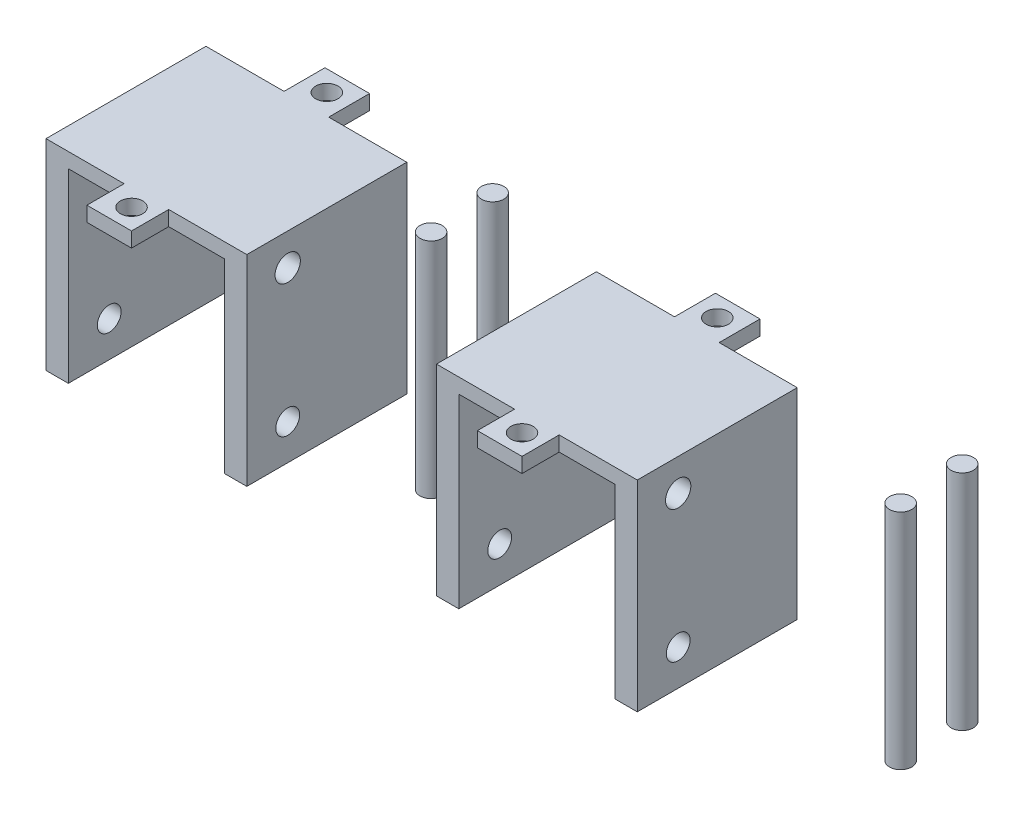
from build123d import *

# Parameters (mm, degrees)
SKETCH1_W                 = 27
SKETCH1_H                 = 27
BOSS_EXTRUDE1_DEPTH       = 36.7
SKETCH2_W                 = 21
SKETCH2_H                 = 25
CUT_EXTRUDE1_DEPTH        = 36.7
SKETCH3_R                 = 1.7
SKETCH3_R_2               = 1.6
CUT_EXTRUDE2_DEPTH        = 36.7
SKETCH4_R                 = 3
CUT_EXTRUDE3_DEPTH        = 36.7
SKETCH8_R                 = 1.5
BOSS_EXTRUDE3_DEPTH       = 30
BOSS_EXTRUDE3_2_DEPTH     = 30
SKETCH9_W                 = 5.918746276
SKETCH9_H                 = 6
SKETCH9_W_2               = 6.707912446
CUT_EXTRUDE4_DEPTH        = 12
SKETCH11_W                = 15.191448775
SKETCH11_H                = 37.067540439
CUT_EXTRUDE6_DEPTH        = 32
SKETCH15_W                = 6
SKETCH15_H                = 12.008551225
SKETCH15_R                = 1.5
BOSS_EXTRUDE5_DEPTH       = 2.5
SKETCH17_W                = 99.088440485
SKETCH17_H                = 65.829588933
CUT_EXTRUDE9_DEPTH        = 50
SKETCH18_W                = 6
SKETCH18_H                = 2
BOSS_EXTRUDE6_DEPTH       = 5
SKETCH19_R                = 1.5
CUT_EXTRUDE10_DEPTH       = 5
SKETCH20_W                = 6
SKETCH20_H                = 5.5
SKETCH20_R                = 1.5
BOSS_EXTRUDE7_DEPTH       = 2
BODY_MOVE_COPY8_START     = -37.96401366
BODY_MOVE_COPY8_OUTLINE_R = 1.5
BODY_MOVE_COPY8_DEPTH     = 30


# Read off the part's stored shape, not the designer's step: Body-Move/Copy8
with BuildPart() as part:
    # Sketch1 → Boss-Extrude1 (new body)
    with BuildSketch(Plane.XY):
        with Locations((-15.677732696, -21.46401366)):
            Rectangle(SKETCH1_W, SKETCH1_H)
    extrude(amount=BOSS_EXTRUDE1_DEPTH)

    # Sketch2 → Cut-Extrude1 (cut)
    with BuildSketch(Plane(origin=(0, 0, 0), x_dir=(-1, 0, 0), z_dir=(0, 0, -1))):
        with Locations((15.677732696, -22.46401366)):
            Rectangle(SKETCH2_W, SKETCH2_H)
    extrude(amount=-CUT_EXTRUDE1_DEPTH, mode=Mode.SUBTRACT)

    # Sketch3 → Cut-Extrude2 (cut)
    with BuildSketch(Plane(origin=(-2.177732696, 0, 0), x_dir=(0, 0, -1), z_dir=(1, 0, 0))):
        with Locations((-31.2, -12.26401366)):
            Circle(SKETCH3_R)
        with Locations((-31.2, -30.16401366)):
            Circle(SKETCH3_R_2)
    extrude(amount=-CUT_EXTRUDE2_DEPTH, mode=Mode.SUBTRACT)

    # Sketch4 → Cut-Extrude3 (cut)
    with BuildSketch(Plane(origin=(-2.177732696, 0, 0), x_dir=(0, 0, -1), z_dir=(1, 0, 0))):
        with Locations((-12.025092395, -21.16401366)):
            Circle(SKETCH4_R)
    extrude(amount=-CUT_EXTRUDE3_DEPTH, mode=Mode.SUBTRACT)

    # Sketch9 → Cut-Extrude4 (cut)
    with BuildSketch(Plane(origin=(0, 0, 0), x_dir=(-1, 0, 0), z_dir=(0, 0, -1))):
        with Locations((3.689038825, -21.16401366)):
            Rectangle(SKETCH9_W, SKETCH9_H)
        with Locations((28.103867214, -21.16401366)):
            Rectangle(SKETCH9_W_2, SKETCH9_H)
    extrude(amount=-CUT_EXTRUDE4_DEPTH, mode=Mode.SUBTRACT)

    # Sketch11 → Cut-Extrude6 (cut)
    with BuildSketch(Plane.ZY.offset(29.177732696)):
        with Locations((7.595724388, -16.43024344)):
            Rectangle(SKETCH11_W, SKETCH11_H)
    extrude(amount=-CUT_EXTRUDE6_DEPTH, mode=Mode.SUBTRACT)


with BuildPart() as body_2:
    # Sketch8 → Boss-Extrude3 (new body)
    with BuildSketch(Plane(origin=(0, -7.96401366, 0), x_dir=(1, 0, 0), z_dir=(0, 1, 0))):
        with Locations(Location((7.15742756, -12.973989901, 0), (0, 0, 180))):
            Circle(SKETCH8_R)
    extrude(amount=-BOSS_EXTRUDE3_DEPTH)


with BuildPart() as body_3:
    # Sketch8 → Boss-Extrude3 2 (new body)
    with BuildSketch(Plane(origin=(0, -7.96401366, 0), x_dir=(1, 0, 0), z_dir=(0, 1, 0))):
        with Locations(Location((7.574350551, -21.669812293, 0), (0, 0, 180))):
            Circle(SKETCH8_R)
    extrude(amount=-BOSS_EXTRUDE3_2_DEPTH)


with BuildPart() as body_4:
    # Body-Move/Copy4: copy of part
    add(part.part.moved(Location((-70.821628829, 0, 0))))

    # Sketch15 → Boss-Extrude5 (add)
    with BuildSketch(Plane(origin=(0, -7.96401366, 0), x_dir=(1, 0, 0), z_dir=(0, 1, 0))):
        with Locations((-69.999361524, -25.945724388)):
            Rectangle(SKETCH15_W, SKETCH15_H)
        with Locations(Location((-69.999361524, -22.941448775, 0), (0, 0, 180))):
            Circle(SKETCH15_R, mode=Mode.SUBTRACT)
        with Locations(Location((-69.999361524, -28.95, 0), (0, 0, 180))):
            Circle(SKETCH15_R, mode=Mode.SUBTRACT)
    extrude(amount=-BOSS_EXTRUDE5_DEPTH)


with BuildPart() as body_5:
    # Body-Move/Copy5: copy of body 2
    add(body_2.part.moved(Location((-69.754488263, 0, 0))))


with BuildPart() as body_6:
    # Body-Move/Copy6: copy of body 3
    add(body_3.part.moved(Location((-71.521118541, 0, 0))))


with BuildPart() as cut_extrude9_tool:
    # Sketch17 → Cut-Extrude9 (new body)
    with BuildSketch(Plane(origin=(0, -7.96401366, 0), x_dir=(1, 0, 0), z_dir=(0, 1, 0))):
        with Locations((-104.540526015, -10.422992559)):
            Rectangle(SKETCH17_W, SKETCH17_H)
    extrude(amount=-CUT_EXTRUDE9_DEPTH)


with BuildPart() as body_4_1:
    add(body_4.part)

    # Cut-Extrude9: cut by cut_extrude9_tool
    add(cut_extrude9_tool.part, mode=Mode.SUBTRACT)


with BuildPart() as body_5_1:
    add(body_5.part)

    # Cut-Extrude9: cut by cut_extrude9_tool
    add(cut_extrude9_tool.part, mode=Mode.SUBTRACT)


with BuildPart() as body_6_1:
    add(body_6.part)

    # Cut-Extrude9: cut by cut_extrude9_tool
    add(cut_extrude9_tool.part, mode=Mode.SUBTRACT)


with BuildPart() as part_1:
    add(part.part)

    # Sketch18 → Boss-Extrude6 (add)
    with BuildSketch(Plane.XY.offset(36.7)):
        with Locations((-15.677732696, -8.96401366)):
            Rectangle(SKETCH18_W, SKETCH18_H)
    extrude(amount=BOSS_EXTRUDE6_DEPTH)

    # Sketch19 → Cut-Extrude10 (cut)
    with BuildSketch(Plane(origin=(0, -7.96401366, 0), x_dir=(1, 0, 0), z_dir=(0, 1, 0))):
        with Locations(Location((-15.427732696, -38.95, 0), (0, 0, 180))):
            Circle(SKETCH19_R)
    extrude(amount=-CUT_EXTRUDE10_DEPTH, mode=Mode.SUBTRACT)

    # Sketch20 → Boss-Extrude7 (add)
    with BuildSketch(Plane.XZ.offset(9.96401366)):
        with Locations((-15.677732696, 12.441448775)):
            Rectangle(SKETCH20_W, SKETCH20_H)
        with Locations((-15.677732696, 12.441448775)):
            Circle(SKETCH20_R, mode=Mode.SUBTRACT)
    extrude(amount=-BOSS_EXTRUDE7_DEPTH)


with BuildPart() as body_4_2:
    # Body-Move/Copy7: copy of part
    add(part_1.part.moved(Location((52.503676829, 0, 0))))


with BuildPart() as body_5_2:
    # Body-Move/Copy8 outline → Body-Move/Copy8 (new body)
    with BuildSketch(Plane(origin=(0, 0, 0), x_dir=(1, 0, 0), z_dir=(0, 1, 0)).offset(BODY_MOVE_COPY8_START)):
        with Locations((70.709770924, -21.669812293)):
            Circle(BODY_MOVE_COPY8_OUTLINE_R)
        with Locations((70.292847932, -12.973989901)):
            Circle(BODY_MOVE_COPY8_OUTLINE_R)
    extrude(amount=BODY_MOVE_COPY8_DEPTH)


solid = Compound([body_2.part, body_3.part, part_1.part, body_4_2.part, body_5_2.part])
